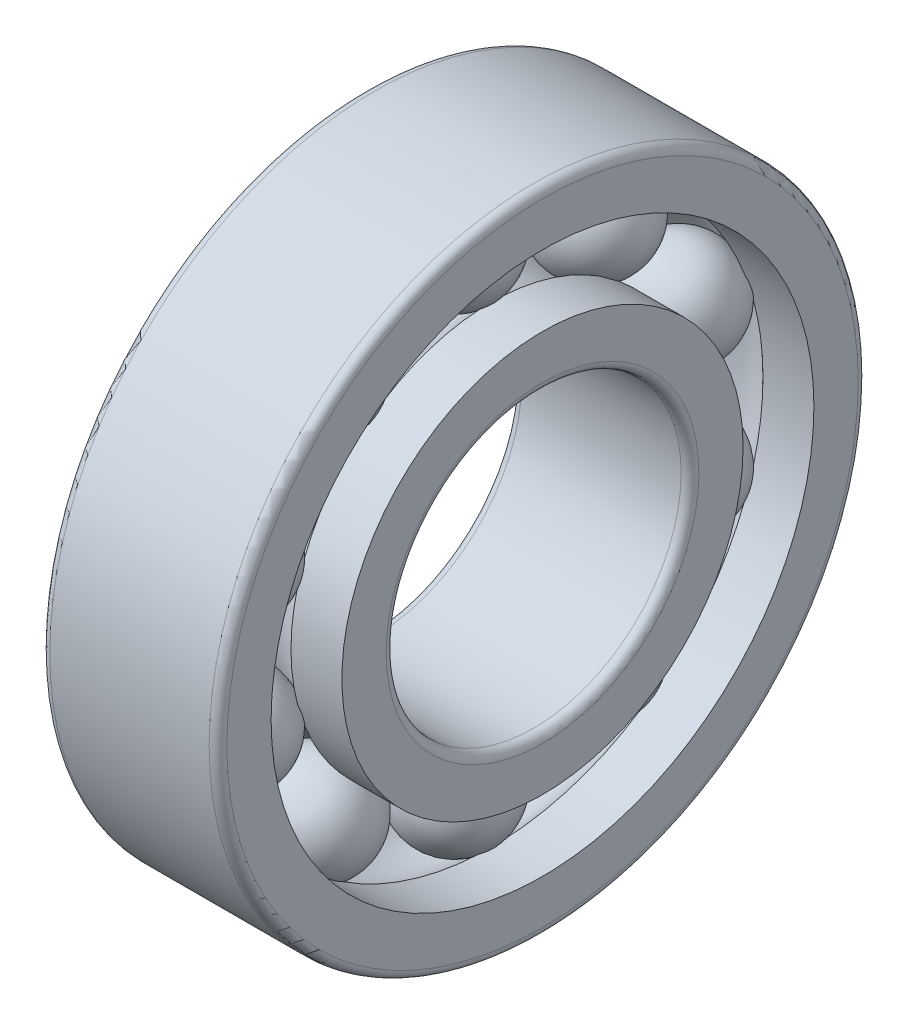
from build123d import *

# Parameters (mm, degrees)
CAGSPISKE_W         = 0.18
CAGSPISKE_H         = 0.3
CAGESPINE_ANGLE     = 0.001
BALLSDETAILED_COUNT = 10
BALLSDETAILED_ANGLE = 324


with BuildPart() as part:
    # CagSpiSke → CageSpine (revolve)
    with BuildSketch(Plane.XY):
        with Locations((0, 4)):
            Rectangle(CAGSPISKE_W, CAGSPISKE_H)
    revolve(axis=Axis((-20.6375, 0, 0), (-1, 0, 0)), revolution_arc=CAGESPINE_ANGLE)

    # BalDetSke → BallDetailed (revolve)
    with BuildSketch(Plane.XY):
        with BuildLine():
            Line((-0.9, 4), (0.9, 4))
            ThreePointArc((0.9, 4), (0, 3.1), (-0.9, 4))
        make_face()
    balldetailed = revolve(axis=Axis((-1.905, 4, 0), (1, 0, 0)))

    # InnRacSke → InnerRace (revolve)
    with BuildSketch(Plane.XY):
        with BuildLine():
            Line((-0.63688696, 3.4), (-1.5, 3.4))
            Line((-1.5, 3.4), (-1.5, 2.65))
            ThreePointArc((-1.5, 2.65), (-1.456066017, 2.543933983), (-1.35, 2.5))
            Line((-1.35, 2.5), (1.35, 2.5))
            ThreePointArc((1.35, 2.5), (1.456066017, 2.543933983), (1.5, 2.65))
            Line((1.5, 2.65), (1.5, 3.4))
            Line((1.5, 3.4), (0.63688696, 3.4))
            ThreePointArc((0.63688696, 3.4), (0, 3.125), (-0.63688696, 3.4))
        make_face()
    revolve(axis=Axis((-20.6375, 0, 0), (1, 0, 0)))

    # OutRacSke → OuterRace (revolve)
    with BuildSketch(Plane.XY):
        with BuildLine():
            Line((-0.63688696, 4.6), (-1.5, 4.6))
            Line((-1.5, 4.6), (-1.5, 5.35))
            ThreePointArc((-1.5, 5.35), (-1.456066017, 5.456066017), (-1.35, 5.5))
            Line((-1.35, 5.5), (1.35, 5.5))
            ThreePointArc((1.35, 5.5), (1.456066017, 5.456066017), (1.5, 5.35))
            Line((1.5, 5.35), (1.5, 4.6))
            Line((1.5, 4.6), (0.63688696, 4.6))
            ThreePointArc((0.63688696, 4.6), (0, 4.875), (-0.63688696, 4.6))
        make_face()
    revolve(axis=Axis((-20.6375, 0, 0), (1, 0, 0)))

    # BallsDetailed: BallDetailed ×10 about axis
    ballsdetailed_axis = Axis((-50, 0, 0), (1, 0, 0))
    for i in range(1, BALLSDETAILED_COUNT):
        add(balldetailed.rotate(ballsdetailed_axis, i * BALLSDETAILED_ANGLE / (BALLSDETAILED_COUNT - 1)))


solid = part.part
